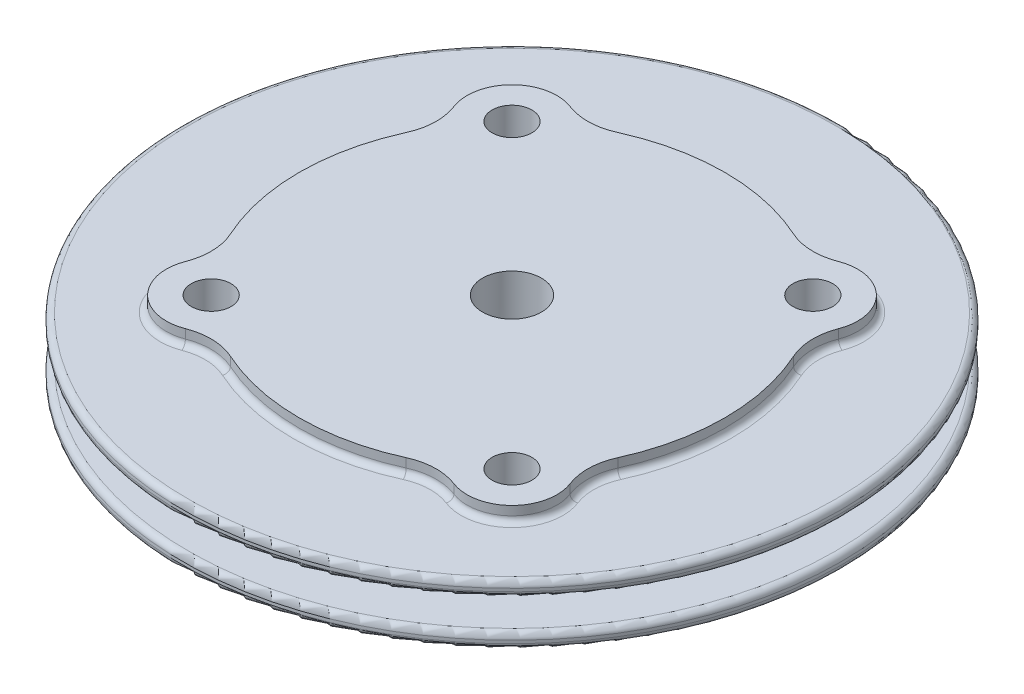
from build123d import *

# Parameters (mm, degrees)
BOSS_EXTRUDE1_DEPTH    = 19.05
M14X1_5_TAPPED_HOLE1_D = 12.5
SKETCH6_R              = 4.2164
CUT_EXTRUDE1_DEPTH     = 101.602920014
FILLET2_R              = 1.27


with BuildPart() as part:
    # Sketch1 → Boss-Extrude1 (new body)
    with BuildSketch(Plane(origin=(0, 0, 0), x_dir=(1, 0, 0), z_dir=(0, 1, 0))):
        with BuildLine():
            ThreePointArc((-41.05309521, 18.636002755), (-45.085, 0), (-41.05309521, -18.636002755))
            ThreePointArc((-41.05309521, -18.636002755), (-39.922721795, -23.516147348), (-40.767382723, -28.453768558))
            ThreePointArc((-40.767382723, -28.453768558), (-38.615101321, -38.615101321), (-28.453768558, -40.767382723))
            ThreePointArc((-28.453768558, -40.767382723), (-23.516147348, -39.922721795), (-18.636002755, -41.05309521))
            ThreePointArc((-18.636002755, -41.05309521), (0, -45.085), (18.636002755, -41.05309521))
            ThreePointArc((18.636002755, -41.05309521), (23.516147348, -39.922721795), (28.453768558, -40.767382723))
            ThreePointArc((28.453768558, -40.767382723), (38.615101321, -38.615101321), (40.767382723, -28.453768558))
            ThreePointArc((40.767382723, -28.453768558), (39.922721795, -23.516147348), (41.05309521, -18.636002755))
            ThreePointArc((41.05309521, -18.636002755), (45.085, 0), (41.05309521, 18.636002755))
            ThreePointArc((41.05309521, 18.636002755), (39.922721795, 23.516147348), (40.767382723, 28.453768558))
            ThreePointArc((40.767382723, 28.453768558), (38.615101321, 38.615101321), (28.453768558, 40.767382723))
            ThreePointArc((28.453768558, 40.767382723), (23.516147348, 39.922721795), (18.636002755, 41.05309521))
            ThreePointArc((18.636002755, 41.05309521), (0, 45.085), (-18.636002755, 41.05309521))
            ThreePointArc((-18.636002755, 41.05309521), (-23.516147348, 39.922721795), (-28.453768558, 40.767382723))
            ThreePointArc((-28.453768558, 40.767382723), (-38.615101321, 38.615101321), (-40.767382723, 28.453768558))
            ThreePointArc((-40.767382723, 28.453768558), (-39.922721795, 23.516147348), (-41.05309521, 18.636002755))
        make_face()
    extrude(amount=BOSS_EXTRUDE1_DEPTH)

    # Sketch2 → Revolve1 (revolve)
    with BuildSketch(Plane.XY):
        with BuildLine():
            Line((0, 15.875), (68.58, 15.875))
            ThreePointArc((68.58, 15.875), (69.478025612, 15.503025612), (69.85, 14.605))
            Line((69.85, 14.605), (69.85, 13.97))
            ThreePointArc((69.85, 13.97), (69.478025612, 13.071974388), (68.58, 12.7))
            Line((68.58, 12.7), (0, 12.7))
            Line((0, 12.7), (0, 15.875))
        make_face()
        with BuildLine():
            Line((0, 6.35), (68.58, 6.35))
            ThreePointArc((68.58, 6.35), (69.478025612, 5.978025612), (69.85, 5.08))
            Line((69.85, 5.08), (69.85, 4.445))
            ThreePointArc((69.85, 4.445), (69.478025612, 3.546974388), (68.58, 3.175))
            Line((68.58, 3.175), (0, 3.175))
            Line((0, 3.175), (0, 6.35))
        make_face()
    revolve(axis=Axis((0, 0, 0), (0, 1, 0)))

    # Sketch3 → Cut-Revolve1 (revolve, cut)
    with BuildSketch(Plane.XY):
        with BuildLine():
            Line((0, 1.27), (0, 0))
            Line((0, 0), (38.1, 0))
            ThreePointArc((38.1, 0), (19.060580395, 0.952411855), (0, 1.27))
        make_face()
    revolve(axis=Axis((0, 0, 0), (0, 1, 0)), mode=Mode.SUBTRACT)

    # M14x1.5 Tapped Hole1 (through all)
    with Locations(Plane(origin=(0, 19.05, 0), x_dir=(1, 0, 0), z_dir=(0, 1, 0))):
        with Locations((0, 0)):
            Hole(M14X1_5_TAPPED_HOLE1_D / 2)

    # Sketch6 → Cut-Extrude1 (cut, through all)
    with BuildSketch(Plane(origin=(0, 19.05, 0), x_dir=(1, 0, 0), z_dir=(0, 1, 0))):
        with Locations(Location((-31.87990923, 31.87990923, 0), (0, 0, 270))):
            Circle(SKETCH6_R)
        with Locations(Location((31.87990923, 31.87990923, 0), (0, 0, 270))):
            Circle(SKETCH6_R)
        with Locations(Location((31.87990923, -31.87990923, 0), (0, 0, 270))):
            Circle(SKETCH6_R)
        with Locations(Location((-31.87990923, -31.87990923, 0), (0, 0, 270))):
            Circle(SKETCH6_R)
    extrude(amount=-CUT_EXTRUDE1_DEPTH, mode=Mode.SUBTRACT)

    # Fillet1: read off the stored shape, not the designer's step
    # Fillet1 outline → Fillet1 (revolve, cut)
    with BuildSketch(Plane.XY):
        with BuildLine():
            Line((6.25, 1.075730612), (14.908349727, 1.075730612))
            ThreePointArc((14.908349727, 1.075730612), (8.772446666, 3.758974049), (6.25, 9.962711998))
            Line((6.25, 9.962711998), (6.25, 1.075730612))
        make_face()
    revolve(axis=Axis((0, 0, 0), (0, 1, 0)), mode=Mode.SUBTRACT)

    # Fillet2
    fillet2_edges = [part.edges().sort_by_distance(p)[0] for p in [
        (-23.516147348, 3.175, -39.922721795),
        (0, 3.175, -45.085),
        (38.615101321, 3.175, -38.615101321),
        (39.922721795, 3.175, -23.516147348),
        (45.085, 3.175, 0),
        (39.922721795, 3.175, 23.516147348),
        (38.615101321, 3.175, 38.615101321),
        (23.516147348, 3.175, 39.922721795),
        (0, 3.175, 45.085),
        (-23.516147348, 3.175, 39.922721795),
        (-38.615101321, 3.175, 38.615101321),
        (-39.922721795, 3.175, 23.516147348),
        (-45.085, 3.175, 0),
        (-39.922721795, 3.175, -23.516147348),
        (-38.615101321, 3.175, -38.615101321),
        (0, 6.35, -45.085),
        (-23.516147348, 6.35, -39.922721795),
        (-38.615101321, 6.35, -38.615101321),
        (-39.922721795, 6.35, -23.516147348),
        (-45.085, 6.35, 0),
        (-39.922721795, 6.35, 23.516147348),
        (-38.615101321, 6.35, 38.615101321),
        (-23.516147348, 6.35, 39.922721795),
        (0, 6.35, 45.085),
        (23.516147348, 6.35, 39.922721795),
        (38.615101321, 6.35, 38.615101321),
        (39.922721795, 6.35, 23.516147348),
        (45.085, 6.35, 0),
        (39.922721795, 6.35, -23.516147348),
        (38.615101321, 6.35, -38.615101321),
        (23.516147348, 15.875, -39.922721795),
        (23.516147348, 12.7, -39.922721795),
        (-23.516147348, 12.7, -39.922721795),
        (0, 12.7, -45.085),
        (38.615101321, 12.7, -38.615101321),
        (39.922721795, 12.7, -23.516147348),
        (45.085, 12.7, 0),
        (39.922721795, 12.7, 23.516147348),
        (38.615101321, 12.7, 38.615101321),
        (23.516147348, 12.7, 39.922721795),
        (0, 12.7, 45.085),
        (-23.516147348, 12.7, 39.922721795),
        (-38.615101321, 12.7, 38.615101321),
        (-39.922721795, 12.7, 23.516147348),
        (-45.085, 12.7, 0),
        (-39.922721795, 12.7, -23.516147348),
        (-38.615101321, 12.7, -38.615101321),
        (0, 15.875, -45.085),
        (-23.516147348, 15.875, -39.922721795),
        (-38.615101321, 15.875, -38.615101321),
        (-39.922721795, 15.875, -23.516147348),
        (-45.085, 15.875, 0),
        (-39.922721795, 15.875, 23.516147348),
        (-38.615101321, 15.875, 38.615101321),
        (-23.516147348, 15.875, 39.922721795),
        (0, 15.875, 45.085),
        (23.516147348, 15.875, 39.922721795),
        (38.615101321, 15.875, 38.615101321),
        (39.922721795, 15.875, 23.516147348),
        (45.085, 15.875, 0),
        (39.922721795, 15.875, -23.516147348),
        (38.615101321, 15.875, -38.615101321),
        (23.516147348, 6.35, -39.922721795),
        (23.516147348, 3.175, -39.922721795),
    ]]
    fillet(fillet2_edges, radius=FILLET2_R)


solid = part.part
